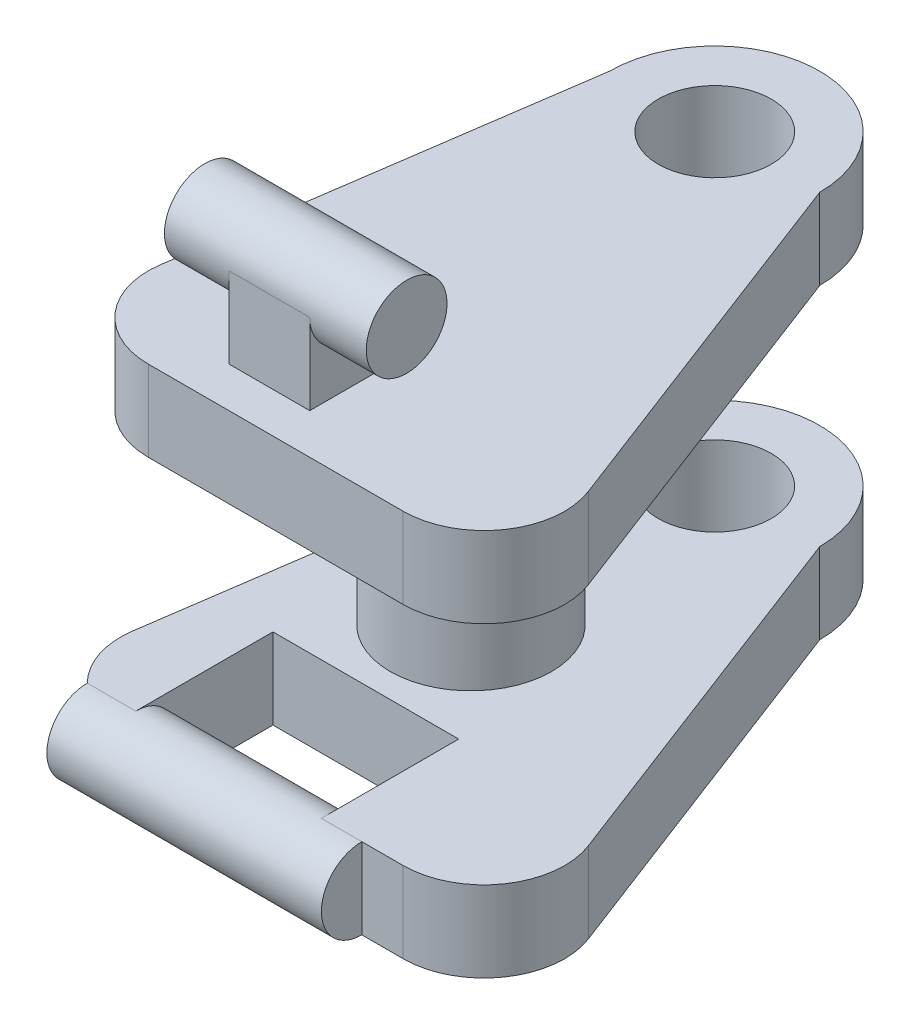
from build123d import *

# Parameters (mm, degrees)
SKETCH1_R                = 13
SKETCH1_R_2              = 7
BOSS_EXTRUDE2_DEPTH      = 10
SKETCH2_R                = 10
BOSS_EXTRUDE3_DEPTH      = 28
SKETCH3_R                = 10
SKETCH3_R_2              = 13
SKETCH3_R_3              = 7
BOSS_EXTRUDE4_DEPTH      = 10
FILLET2_R                = 10
CUT_EXTRUDE1_DEPTH       = 17
BOSS_EXTRUDE5_DEPTH      = 29
BOSS_EXTRUDE5_DEPTH_BACK = 5
SKETCH5_R                = 5
FILLET3_R                = 10
SKETCH6_R                = 10
BOSS_EXTRUDE6_DEPTH      = 10
SKETCH7_W                = 10
SKETCH7_H                = 10
BOSS_EXTRUDE7_DEPTH      = 10
BOSS_EXTRUDE8_DEPTH      = 8
BOSS_EXTRUDE8_DEPTH_BACK = 17
SKETCH8_R                = 5


with BuildPart() as part:
    # Sketch1 → Boss-Extrude2 (new body)
    # profile 1 of 2: a face of its own
    with BuildSketch(Plane(origin=(0, 0, 0), x_dir=(1, 0, 0), z_dir=(0, 1, 0))):
        with BuildLine():
            ThreePointArc((29.247640438, 60), (16.247640438, 47), (3.247640438, 60))
            Line((3.247640438, 60), (-5.462946679, 0))
            Line((-5.462946679, 0), (52.203983694, 0))
            Line((52.203983694, 0), (29.247640438, 60))
        make_face()
    # profile 2 of 2: a face of its own
    with BuildSketch(Plane(origin=(0, 0, 0), x_dir=(1, 0, 0), z_dir=(0, 1, 0))):
        with Locations((16.247640438, 60)):
            Circle(SKETCH1_R)
        with Locations(Location((16.247640438, 60, 0), (0, 0, 270))):
            Circle(SKETCH1_R_2, mode=Mode.SUBTRACT)
    extrude(amount=BOSS_EXTRUDE2_DEPTH)

    # Sketch2 → Boss-Extrude3 (add)
    with BuildSketch(Plane.XZ):
        with Locations(Location((16.05250876, -30, 0), (0, 0, 90))):
            Circle(SKETCH2_R)
    extrude(amount=BOSS_EXTRUDE3_DEPTH)

    # Fillet2
    fillet2_edges = [part.edges().sort_by_distance(p)[0] for p in [
        (52.203983694, 5, 0),
        (-5.462946679, 5, 0),
    ]]
    fillet(fillet2_edges, radius=FILLET2_R)



with BuildPart() as body_2:
    # Sketch3 → Boss-Extrude4 (new body)
    # profile 1 of 2: a face of its own
    with BuildSketch(Plane.XZ.offset(28)):
        with BuildLine():
            Line((-5.462946679, 0), (3.247640438, -60))
            ThreePointArc((3.247640438, -60), (16.247640438, -47), (29.247640438, -60))
            Line((29.247640438, -60), (52.203983694, 0))
            Line((52.203983694, 0), (-5.462946679, 0))
        make_face()
        with Locations(Location((16.05250876, -30, 0), (0, 0, 90))):
            Circle(SKETCH3_R, mode=Mode.SUBTRACT)
    # profile 2 of 2: a face of its own
    with BuildSketch(Plane.XZ.offset(28)):
        with Locations((16.247640438, -60)):
            Circle(SKETCH3_R_2)
        with Locations(Location((16.247640438, -60, 0), (0, 0, 90))):
            Circle(SKETCH3_R_3, mode=Mode.SUBTRACT)
    extrude(amount=BOSS_EXTRUDE4_DEPTH)

    # Sketch4 → Cut-Extrude1 (cut)
    with BuildSketch(Plane.XY):
        Polygon((4.537053321, -33), (4.537053321, -38), (27.537053321, -38), (27.537053321, -28), (4.537053321, -28), align=None)
    extrude(amount=-CUT_EXTRUDE1_DEPTH, mode=Mode.SUBTRACT)

    # Sketch5 → Boss-Extrude5 (add, two sides: drawn at the far end of the back side and taken through both)
    with BuildSketch(Plane.ZY.offset(-27.537053321).offset(-BOSS_EXTRUDE5_DEPTH_BACK)):
        with Locations(Location((0, -33, 0), (0, 0, 270))):
            Circle(SKETCH5_R)
    extrude(amount=BOSS_EXTRUDE5_DEPTH + BOSS_EXTRUDE5_DEPTH_BACK)

    # Fillet3
    # the kernel refuses this fillet: 10 mm, written as the material it takes off along each edge
    with BuildSketch(Plane(origin=(-5.462946679, -6.641526704, 0), x_dir=(0.14367033386913813, 0, -0.989625603531927), z_dir=(0, -1, 0))) as fillet3_piece_1:
        with BuildLine():
            CenterArc((8.543389319, 10), FILLET3_R, 217.167683939, 52.832316061)
            Line((0.574681335, 3.958502414), (0.415307176, 3.837672462))
            ThreePointArc((0.415307176, 3.837672462), (0.089415547, 2.007985274), (-0.197925121, 0.028734067))
            Line((-0.197925121, 0.028734067), (0, -0.2))
            Line((0, -0.2), (8.543389319, -0.2))
            Line((8.543389319, -0.2), (8.543389319, 0))
        make_face()
    extrude(amount=52.716946593, mode=Mode.SUBTRACT)
    with BuildSketch(Plane(origin=(52.203983694, 8.33251049, 0), x_dir=(-0.35734343452809125, 0, -0.9339730562493052), z_dir=(0, -1, 0))) as fillet3_piece_2:
        with BuildLine():
            CenterArc((FILLET3_R * 1.45330041958, -FILLET3_R), FILLET3_R, 90, 110.9371366)
            Line((FILLET3_R * 0.519327363336, -FILLET3_R * 1.35734343453), (FILLET3_R * 0.500647902211, -FILLET3_R * 1.36449030322))
            Line((FILLET3_R * 0.500647902211, -FILLET3_R * 1.36449030322), (-FILLET3_R * 0.0290660083917, FILLET3_R * 0.02))
            Line((-FILLET3_R * 0.0290660083917, FILLET3_R * 0.02), (FILLET3_R * 1.45330041958, FILLET3_R * 0.02))
            Line((FILLET3_R * 1.45330041958, FILLET3_R * 0.02), (FILLET3_R * 1.45330041958, 0))
        make_face()
    extrude(amount=82.665020979, mode=Mode.SUBTRACT)


with BuildPart() as part_1:
    add(part.part)

    add(body_2.part)  # Boss-Extrude6 merges body 2
    # Sketch6 → Boss-Extrude6 (add)
    with BuildSketch(Plane.XZ.offset(28)):
        with Locations(Location((16.05250876, -30, 0), (0, 0, 90))):
            Circle(SKETCH6_R)
    extrude(amount=BOSS_EXTRUDE6_DEPTH)

    # Sketch7 → Boss-Extrude7 (add)
    with BuildSketch(Plane(origin=(0, 10, 0), x_dir=(1, 0, 0), z_dir=(0, 1, 0))):
        with Locations((16.093649369, 10)):
            Rectangle(SKETCH7_W, SKETCH7_H)
    extrude(amount=BOSS_EXTRUDE7_DEPTH)

    # Sketch8 → Boss-Extrude8 (add, two sides: drawn at the far end of the back side and taken through both)
    with BuildSketch(Plane.ZY.offset(-11.093649369).offset(-BOSS_EXTRUDE8_DEPTH_BACK)):
        with Locations((-10, 20)):
            Circle(SKETCH8_R)
    extrude(amount=BOSS_EXTRUDE8_DEPTH + BOSS_EXTRUDE8_DEPTH_BACK)


solid = part_1.part
